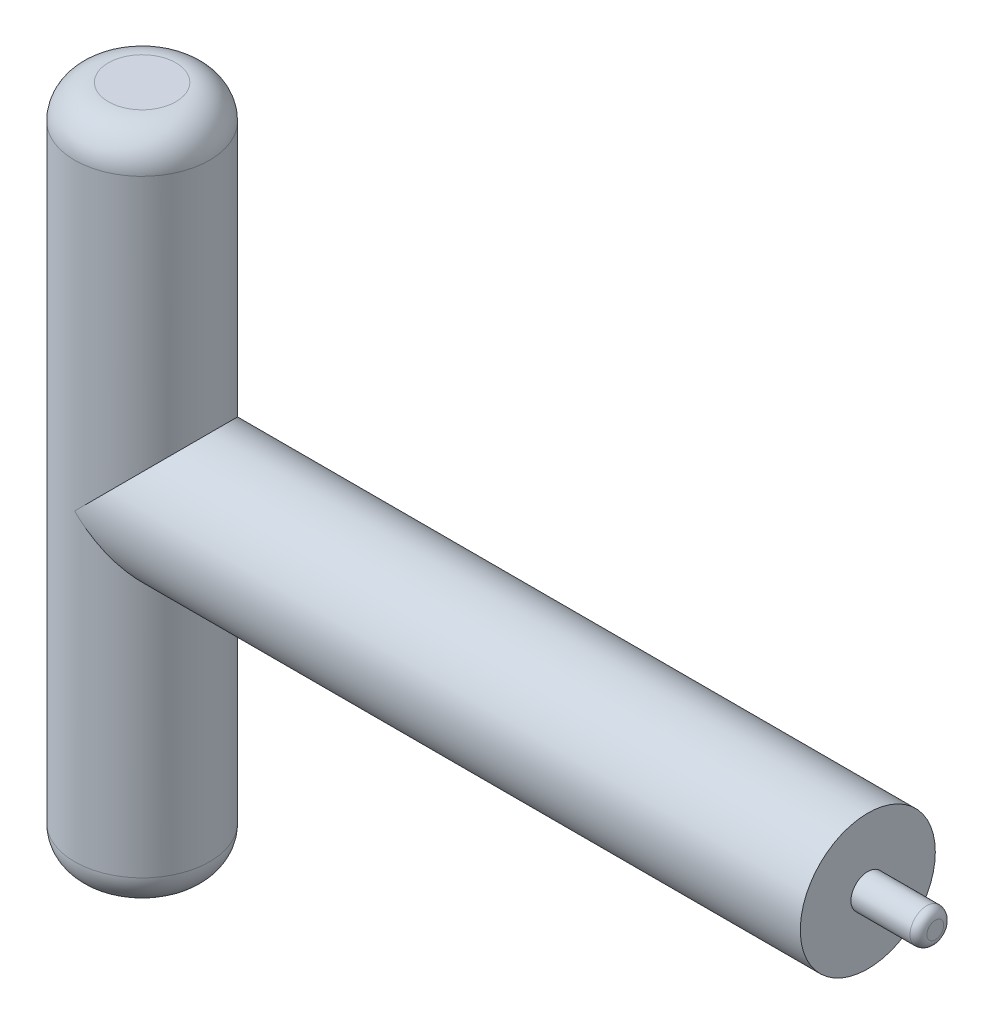
from build123d import *

# Parameters (mm, degrees)
SKETCH1_R                = 12.7
BOSS_EXTRUDE1_DEPTH      = 136.525
SKETCH2_R                = 3.175
BOSS_EXTRUDE2_DEPTH      = 12.7
FILLET2_R                = 1.5875
BOSS_EXTRUDE3_DEPTH      = 63.5
BOSS_EXTRUDE3_DEPTH_BACK = 63.5
SKETCH3_R                = 12.7
FILLET3_R                = 6.35


with BuildPart() as part:
    # Sketch1 → Boss-Extrude1 (new body)
    with BuildSketch(Plane(origin=(0, 0, 0), x_dir=(0, 0, -1), z_dir=(1, 0, 0))):
        Circle(SKETCH1_R)
    extrude(amount=BOSS_EXTRUDE1_DEPTH)

    # Sketch2 → Boss-Extrude2 (add)
    with BuildSketch(Plane(origin=(136.525, 0, 0), x_dir=(0, 0, -1), z_dir=(1, 0, 0))):
        Circle(SKETCH2_R)
    extrude(amount=BOSS_EXTRUDE2_DEPTH)

    # Fillet2
    fillet2_edges = [part.edges().sort_by_distance(p)[0] for p in [
        (149.225, 0, 3.175),
    ]]
    fillet(fillet2_edges, radius=FILLET2_R)

    # Sketch3 → Boss-Extrude3 (add, two sides: drawn at the far end of the back side and taken through both)
    with BuildSketch(Plane(origin=(0, 0, 0), x_dir=(1, 0, 0), z_dir=(0, 1, 0)).offset(-BOSS_EXTRUDE3_DEPTH_BACK)):
        Circle(SKETCH3_R)
    extrude(amount=BOSS_EXTRUDE3_DEPTH + BOSS_EXTRUDE3_DEPTH_BACK)

    # Fillet3
    fillet3_edges = [part.edges().sort_by_distance(p)[0] for p in [
        (-12.7, 63.5, 0),
        (-12.7, -63.5, 0),
    ]]
    fillet(fillet3_edges, radius=FILLET3_R)


solid = part.part
